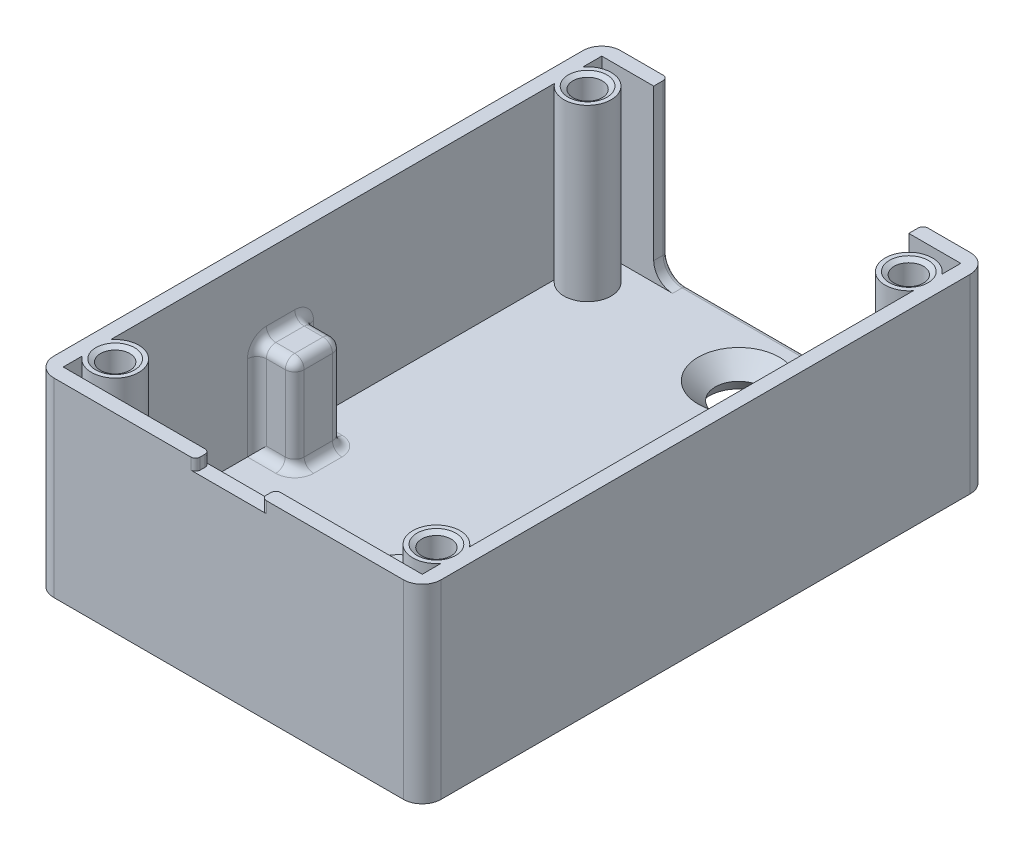
from build123d import *
from OCP.BRepFilletAPI import BRepFilletAPI_MakeChamfer

# Parameters (mm, degrees)
SKETCH_1_W          = 41
SKETCH_1_H          = 60
SKETCH_1_R          = 2.3
SKETCH_1_R_2        = 1.9
EXTRUDE_1_DEPTH     = 3
CHAMFER_1_SIZE      = 2
SKETCH_2_W          = 41
SKETCH_2_H          = 60
SKETCH_2_W_2        = 38
SKETCH_2_H_2        = 57
EXTRUDE_1_2_DEPTH   = 18
SKETCH_3_W          = 27
SKETCH_3_H          = 3.030341357
CUT_EXTRUDE_1_DEPTH = 18
SKETCH_4_R          = 2.5
EXTRUDE_2_DEPTH     = 18
SKETCH_5_R          = 1.55
CUT_EXTRUDE_2_DEPTH = 10
SKETCH_7_W          = 7
SKETCH_7_H          = 4.356080651
CUT_EXTRUDE_3_DEPTH = 1.2
FILLET_2_R          = 0.5
FILLET_3_R          = 2
CHAMFER_4_SIZE      = 0.866025404
CHAMFER_4_SIZE_2    = 1.5
CHAMFER_6_SIZE      = 0.5
CHAMFER_6_SIZE2     = 0.288675135
SKETCH_8_W          = 4
SKETCH_8_H          = 5
EXTRUDE_3_DEPTH     = 10
FILLET_6_R          = 1
FILLET_7_R          = 2
FILLET_8_R          = 0.5
CHAMFER_7_SIZE      = 1


with BuildPart() as part:
    # Эскиз1 → Extrude 1 (new body)
    with BuildSketch(Plane(origin=(0, 0, 0), x_dir=(1, 0, 0), z_dir=(0, 1, 0))):
        Rectangle(SKETCH_1_W, SKETCH_1_H)
        with Locations(Location((0, 24, 0), (0, 0, 270))):
            Circle(SKETCH_1_R, mode=Mode.SUBTRACT)
        with Locations(Location((0, -24, 0), (0, 0, 270))):
            Circle(SKETCH_1_R, mode=Mode.SUBTRACT)
        with Locations(Location((0, -12, 0), (0, 0, 270))):
            Circle(SKETCH_1_R_2, mode=Mode.SUBTRACT)
    extrude(amount=EXTRUDE_1_DEPTH)

    # Фаска1
    chamfer_1_edges = [part.edges().sort_by_distance(p)[0] for p in [
        (0, 3, -26.3),
        (0, 3, 21.7),
    ]]
    chamfer(chamfer_1_edges, length=CHAMFER_1_SIZE)

    # Эскиз2 → Extrude 1 2 (add)
    with BuildSketch(Plane(origin=(0, 3, 0), x_dir=(1, 0, 0), z_dir=(0, 1, 0))):
        Rectangle(SKETCH_2_W, SKETCH_2_H)
        Rectangle(SKETCH_2_W_2, SKETCH_2_H_2, mode=Mode.SUBTRACT)
    extrude(amount=EXTRUDE_1_2_DEPTH)

    # Эскиз3 → Вырез-Вытянуть1 (cut)
    with BuildSketch(Plane(origin=(0, 21, 0), x_dir=(1, 0, 0), z_dir=(0, 1, 0))):
        with Locations((0, 29.478101209)):
            Rectangle(SKETCH_3_W, SKETCH_3_H)
    extrude(amount=-CUT_EXTRUDE_1_DEPTH, mode=Mode.SUBTRACT)

    # Эскиз4 → Бобышка-Вытянуть2 (add)
    with BuildSketch(Plane(origin=(0, 3, 0), x_dir=(1, 0, 0), z_dir=(0, 1, 0))):
        with Locations((17, 25)):
            Circle(SKETCH_4_R)
        with Locations((-17, 25)):
            Circle(SKETCH_4_R)
        with Locations((17, -25)):
            Circle(SKETCH_4_R)
        with Locations((-17, -25)):
            Circle(SKETCH_4_R)
    extrude(amount=EXTRUDE_2_DEPTH)

    # Эскиз5 → Вырез-Вытянуть2 (cut)
    with BuildSketch(Plane(origin=(0, 21, 0), x_dir=(1, 0, 0), z_dir=(0, 1, 0))):
        with Locations(Location((17, 25, 0), (0, 0, 270))):
            Circle(SKETCH_5_R)
        with Locations(Location((17, -25, 0), (0, 0, 270))):
            Circle(SKETCH_5_R)
        with Locations(Location((-17, -25, 0), (0, 0, 270))):
            Circle(SKETCH_5_R)
        with Locations(Location((-17, 25, 0), (0, 0, 270))):
            Circle(SKETCH_5_R)
    extrude(amount=-CUT_EXTRUDE_2_DEPTH, mode=Mode.SUBTRACT)

    # Эскиз7 → Вырез-Вытянуть3 (cut)
    with BuildSketch(Plane(origin=(0, 21, 0), x_dir=(1, 0, 0), z_dir=(0, 1, 0))):
        with Locations((0, -28.804800006)):
            Rectangle(SKETCH_7_W, SKETCH_7_H)
    extrude(amount=-CUT_EXTRUDE_3_DEPTH, mode=Mode.SUBTRACT)

    # Скругление2
    fillet_2_edges = [part.edges().sort_by_distance(p)[0] for p in [
        (-3.5, 20.4, 28.5),
        (3.5, 20.4, 28.5),
        (3.5, 20.4, 30),
        (-3.5, 20.4, 30),
    ]]
    fillet(fillet_2_edges, radius=FILLET_2_R)

    # Скругление3
    fillet_3_edges = [part.edges().sort_by_distance(p)[0] for p in [
        (20.5, 10.5, 30),
        (-20.5, 10.5, 30),
        (-20.5, 10.5, -30),
        (20.5, 10.5, -30),
    ]]
    fillet(fillet_3_edges, radius=FILLET_3_R)

    # Фаска4
    # the kernel refuses this chamfer: 1.5, 0.866025404 mm, written as the material it takes off along each edge
    with BuildSketch(Plane(origin=(0, 0, 24), x_dir=(0, 0, 1), z_dir=(-1, 0, 0))) as chamfer_4_piece_1:
        Polygon((2.3 + CHAMFER_4_SIZE, 0), (2.3, CHAMFER_4_SIZE_2), (2.3, 0), align=None)
    revolve(axis=Axis((0, 0, 24), (0, 1, 0)), mode=Mode.SUBTRACT)
    with BuildSketch(Plane(origin=(18.5, 0, -30), x_dir=(0, -0.01932676561270073, 0.999813220622208), z_dir=(-1, 0, 0))) as chamfer_4_piece_2:
        Polygon((CHAMFER_4_SIZE_2 * 0.999813220622, CHAMFER_4_SIZE_2 * 0.0193267656127), (-CHAMFER_4_SIZE * 0.0193267656079, CHAMFER_4_SIZE * 0.999813220373), (0, 0), align=None)
    extrude(amount=37, mode=Mode.SUBTRACT)
    with BuildSketch(Plane(origin=(-20.5, 0, -28), x_dir=(0.999813220622208, -0.01932676561270073, 0), z_dir=(0, 0, 1)), Plane(origin=(20.5, 0, 28), x_dir=(-0.999813220622208, -0.01932676561270073, 0), z_dir=(0, 0, -1))) as chamfer_4_piece_3:
        Polygon((CHAMFER_4_SIZE_2 * 0.999813220622, CHAMFER_4_SIZE_2 * 0.0193267656127), (-CHAMFER_4_SIZE * 0.0193267656079, CHAMFER_4_SIZE * 0.999813220373), (0, 0), align=None)
    extrude(amount=56, mode=Mode.SUBTRACT)
    with BuildSketch(Plane(origin=(-18.5, 0, 30), x_dir=(0, 0.9983227437537924, 0.0578938624026721), z_dir=(1, 0, 0))) as chamfer_4_piece_4:
        Polygon((CHAMFER_4_SIZE * 0.998322743505, -CHAMFER_4_SIZE * 0.0578938623883), (-CHAMFER_4_SIZE_2 * 0.0578938624027, -CHAMFER_4_SIZE_2 * 0.998322743754), (0, 0), align=None)
    extrude(amount=37, mode=Mode.SUBTRACT)
    with BuildSketch(Plane(origin=(-18.5, 0, -28), x_dir=(0, 0, -1), z_dir=(1, 0, 0))) as chamfer_4_piece_5:
        Polygon((2 - CHAMFER_4_SIZE_2, 0), (2, CHAMFER_4_SIZE), (2, 0), align=None)
    revolve(axis=Axis((-18.5, 0, -28), (0, 1, 0)), revolution_arc=90, mode=Mode.SUBTRACT)
    with BuildSketch(Plane(origin=(-18.5, 0, 28), x_dir=(0, 0, 1), z_dir=(1, 0, 0))) as chamfer_4_piece_6:
        Polygon((2 - CHAMFER_4_SIZE_2, 0), (2, -CHAMFER_4_SIZE), (2, 0), align=None)
    revolve(axis=Axis((-18.5, 0, 28), (0, -1, 0)), revolution_arc=90, mode=Mode.SUBTRACT)
    with BuildSketch(Plane(origin=(18.5, 0, 28), x_dir=(0, 0, 1), z_dir=(-1, 0, 0))) as chamfer_4_piece_7:
        Polygon((2, CHAMFER_4_SIZE), (2 - CHAMFER_4_SIZE_2, 0), (2, 0), align=None)
    revolve(axis=Axis((18.5, 0, 28), (0, 1, 0)), revolution_arc=90, mode=Mode.SUBTRACT)
    with BuildSketch(Plane(origin=(18.5, 0, -28), x_dir=(0, 0, -1), z_dir=(-1, 0, 0))) as chamfer_4_piece_8:
        Polygon((2 - CHAMFER_4_SIZE_2, 0), (2, -CHAMFER_4_SIZE), (2, 0), align=None)
    revolve(axis=Axis((18.5, 0, -28), (0, -1, 0)), revolution_arc=90, mode=Mode.SUBTRACT)
    with BuildSketch(Plane(origin=(0, 0, -24), x_dir=(0, 0, 1), z_dir=(-1, 0, 0))) as chamfer_4_piece_9:
        Polygon((2.3 + CHAMFER_4_SIZE, 0), (2.3, CHAMFER_4_SIZE_2), (2.3, 0), align=None)
    revolve(axis=Axis((0, 0, -24), (0, 1, 0)), mode=Mode.SUBTRACT)
    with BuildSketch(Plane(origin=(0, 0, 12), x_dir=(0, 0, 1), z_dir=(-1, 0, 0))) as chamfer_4_piece_10:
        Polygon((1.9 + CHAMFER_4_SIZE, 0), (1.9, CHAMFER_4_SIZE_2), (1.9, 0), align=None)
    revolve(axis=Axis((0, 0, 12), (0, 1, 0)), mode=Mode.SUBTRACT)

    # Фаска6: one chamfer whose edges measure the first distance from different faces: ONE call of the kernel's chamfer builder (chamfer() names one face for all edges)
    chamfer_6_edges_1 = [part.edges().sort_by_distance(p)[0] for p in [
        (-17, 21, -26.55),
        (-17, 21, 23.45),
    ]]
    chamfer_6_side_1 = [part.faces().sort_by_distance(p)[0] for p in [
        (-11.25, 21, 29.376381527),
    ]]
    chamfer_6_edges_2 = [part.edges().sort_by_distance(p)[0] for p in [
        (17, 21, 23.45),
        (17, 21, -26.55),
    ]]
    chamfer_6_side_2 = [part.faces().sort_by_distance(p)[0] for p in [
        (11.25, 21, 29.376381527),
    ]]
    chamfer_6 = BRepFilletAPI_MakeChamfer(part.part.solid().wrapped)
    for e in chamfer_6_edges_1:
        chamfer_6.Add(CHAMFER_6_SIZE, CHAMFER_6_SIZE2, e.wrapped, chamfer_6_side_1[0].wrapped)  # the first distance lies on this face
    for e in chamfer_6_edges_2:
        chamfer_6.Add(CHAMFER_6_SIZE, CHAMFER_6_SIZE2, e.wrapped, chamfer_6_side_2[0].wrapped)  # the first distance lies on this face
    add(Compound.cast(chamfer_6.Shape()), mode=Mode.REPLACE)

    # Эскиз8 → Бобышка-Вытянуть3 (add)
    with BuildSketch(Plane(origin=(0, 3, 0), x_dir=(1, 0, 0), z_dir=(0, 1, 0))):
        with Locations((17, -14)):
            Rectangle(SKETCH_8_W, SKETCH_8_H)
        with Locations((-17, -5.5)):
            Rectangle(SKETCH_8_W, SKETCH_8_H)
    extrude(amount=EXTRUDE_3_DEPTH)

    # Скругление6
    fillet_6_edges = [part.edges().sort_by_distance(p)[0] for p in [
        (19, 8, 16.5),
        (17, 3, 11.5),
        (19, 8, 11.5),
        (15, 3, 14),
        (15, 8, 11.5),
        (17, 3, 16.5),
        (15, 8, 16.5),
        (19, 13, 14),
        (17, 13, 11.5),
        (15, 13, 14),
        (17, 13, 16.5),
        (-19, 8, 3),
        (-17, 3, 8),
        (-19, 8, 8),
        (-15, 3, 5.5),
        (-15, 8, 8),
        (-17, 3, 3),
        (-15, 8, 3),
        (-19, 13, 5.5),
        (-17, 13, 8),
        (-15, 13, 5.5),
        (-17, 13, 3),
    ]]
    fillet(fillet_6_edges, radius=FILLET_6_R)

    # Скругление7
    fillet_7_edges = [part.edges().sort_by_distance(p)[0] for p in [
        (-13.5, 3, -29.25),
        (13.5, 3, -29.25),
    ]]
    fillet(fillet_7_edges, radius=FILLET_7_R)

    # Скругление8
    fillet_8_edges = [part.edges().sort_by_distance(p)[0] for p in [
        (0, 3, -30),
        (13.5, 13, -30),
        (12.914213562, 3.585786438, -30),
        (-12.914213562, 3.585786438, -30),
        (-13.5, 13, -30),
    ]]
    fillet(fillet_8_edges, radius=FILLET_8_R)

    # Фаска7
    chamfer_7_edges = [part.edges().sort_by_distance(p)[0] for p in [
        (0, 3, 10.1),
    ]]
    chamfer(chamfer_7_edges, length=CHAMFER_7_SIZE)


solid = part.part
